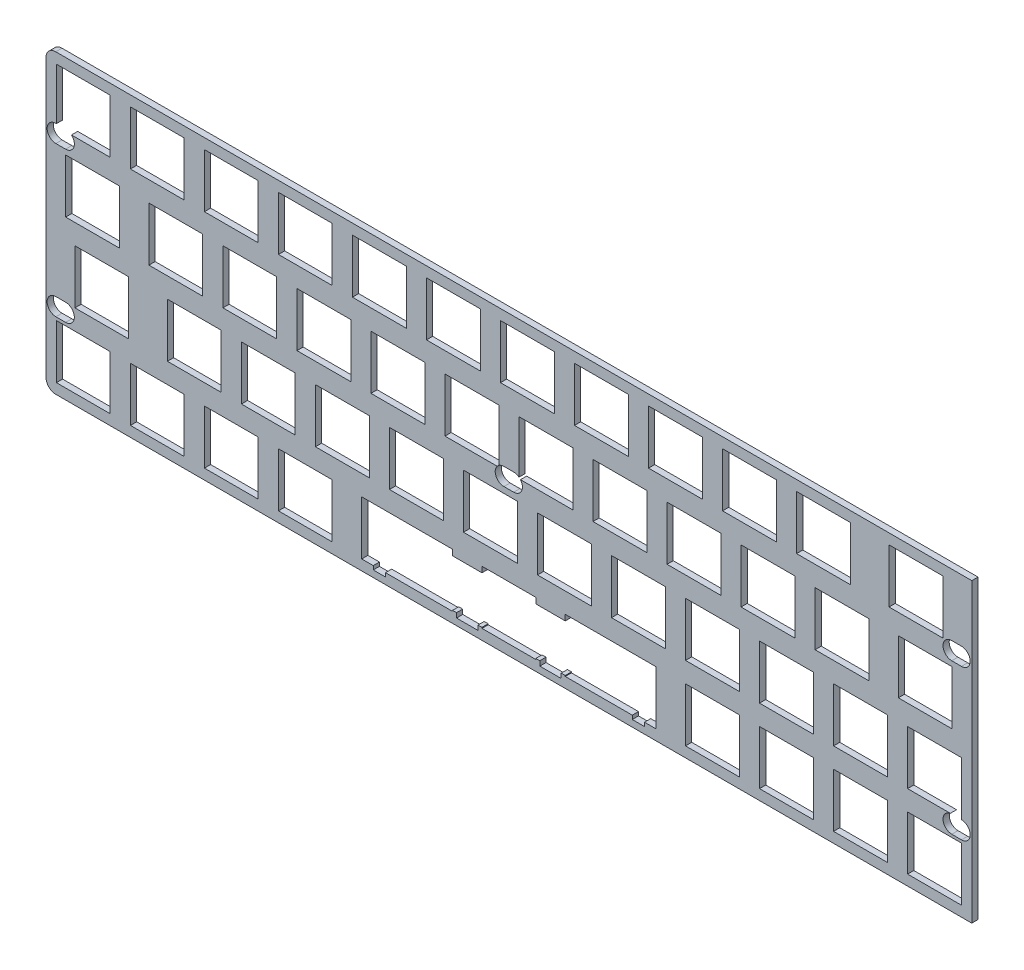
from build123d import *

# Parameters (mm, degrees)
MODEL_W             = 238.2749154
MODEL_H             = 76.350013
MODEL_W_2           = 13.849
MODEL_H_2           = 13.84926
MODEL_W_3           = 13.8491
MODEL_W_4           = 13.84934
MODEL_H_3           = 13.8492
MODEL_W_5           = 13.85
MODEL_W_6           = 13.8504
MODEL_W_7           = 13.85071
MODEL_W_8           = 13.851
MODEL_H_4           = 13.849
MODEL_W_9           = 13.8505
MODEL_W_10          = 13.84928
BOSS_EXTRUDE1_DEPTH = 1.6
FILLET1_R           = 2.5
CUT_EXTRUDE1_DEPTH  = 1.6


with BuildPart() as part:
    # Model → Boss-Extrude1 (new body)
    with BuildSketch(Plane.XY):
        with Locations((119.2325423, 38.2824935)):
            Rectangle(MODEL_W, MODEL_H)
        Polygon((81.3513, 16.6329), (81.3513, 2.78364), (84.3248, 2.78364), (84.3248, 1.8135), (87.4751, 1.8135), (87.4751, 2.78364), (104.725, 2.78364), (104.725, 3.01377), (105.756, 3.01377), (105.756, 1.8135), (111.275, 1.8135), (111.275, 3.01377), (112.306, 3.01377), (112.306, 2.78364), (126.157, 2.78364), (126.157, 3.01377), (127.187, 3.01377), (127.187, 1.8135), (132.707, 1.8135), (132.707, 3.01377), (133.737, 3.01377), (133.737, 2.78364), (150.987, 2.78364), (150.987, 1.8135), (154.138, 1.8135), (154.138, 2.78364), (157.113, 2.78364), (157.113, 16.6329), (133.737, 16.6329), (133.737, 15.1639), (126.157, 15.1639), (126.157, 16.6329), (112.306, 16.6329), (112.306, 15.1639), (104.725, 15.1639), (104.725, 16.6329), align=None, mode=Mode.SUBTRACT)
        with Locations((228.7695, 9.70827)):
            Rectangle(MODEL_W_2, MODEL_H_2, mode=Mode.SUBTRACT)
        with Locations((209.7195, 9.70827)):
            Rectangle(MODEL_W_2, MODEL_H_2, mode=Mode.SUBTRACT)
        with Locations((190.6695, 9.70827)):
            Rectangle(MODEL_W_2, MODEL_H_2, mode=Mode.SUBTRACT)
        with Locations((171.6195, 9.70827)):
            Rectangle(MODEL_W_2, MODEL_H_2, mode=Mode.SUBTRACT)
        with Locations((66.8445, 9.70827)):
            Rectangle(MODEL_W_2, MODEL_H_2, mode=Mode.SUBTRACT)
        with Locations((47.7945, 9.70827)):
            Rectangle(MODEL_W_2, MODEL_H_2, mode=Mode.SUBTRACT)
        with Locations((28.74445, 9.70827)):
            Rectangle(MODEL_W_3, MODEL_H_2, mode=Mode.SUBTRACT)
        with Locations((9.69453, 9.70827)):
            Rectangle(MODEL_W_4, MODEL_H_2, mode=Mode.SUBTRACT)
        with Locations((228.7695, 28.7582)):
            Rectangle(MODEL_W_2, MODEL_H_3, mode=Mode.SUBTRACT)
        with Locations((209.7195, 28.7582)):
            Rectangle(MODEL_W_2, MODEL_H_3, mode=Mode.SUBTRACT)
        with Locations((190.6695, 28.7582)):
            Rectangle(MODEL_W_2, MODEL_H_3, mode=Mode.SUBTRACT)
        with Locations((171.6195, 28.7582)):
            Rectangle(MODEL_W_2, MODEL_H_3, mode=Mode.SUBTRACT)
        with Locations((152.569, 28.7582)):
            Rectangle(MODEL_W_5, MODEL_H_3, mode=Mode.SUBTRACT)
        with Locations((133.519, 28.7582)):
            Rectangle(MODEL_W_5, MODEL_H_3, mode=Mode.SUBTRACT)
        with Locations((114.469, 28.7582)):
            Rectangle(MODEL_W_5, MODEL_H_3, mode=Mode.SUBTRACT)
        with Locations((95.4188, 28.7582)):
            Rectangle(MODEL_W_6, MODEL_H_3, mode=Mode.SUBTRACT)
        with Locations((76.3695, 28.7582)):
            Rectangle(MODEL_W_2, MODEL_H_3, mode=Mode.SUBTRACT)
        with Locations((57.3195, 28.7582)):
            Rectangle(MODEL_W_2, MODEL_H_3, mode=Mode.SUBTRACT)
        with Locations((38.26945, 28.7582)):
            Rectangle(MODEL_W_3, MODEL_H_3, mode=Mode.SUBTRACT)
        with Locations((14.456345, 28.7582)):
            Rectangle(MODEL_W_7, MODEL_H_3, mode=Mode.SUBTRACT)
        with Locations((226.3875, 47.8083)):
            Rectangle(MODEL_W_8, MODEL_H_4, mode=Mode.SUBTRACT)
        with Locations((204.9565, 47.8083)):
            Rectangle(MODEL_W_8, MODEL_H_4, mode=Mode.SUBTRACT)
        with Locations((185.9065, 47.8083)):
            Rectangle(MODEL_W_8, MODEL_H_4, mode=Mode.SUBTRACT)
        with Locations((166.8565, 47.8083)):
            Rectangle(MODEL_W_8, MODEL_H_4, mode=Mode.SUBTRACT)
        with Locations((147.8065, 47.8083)):
            Rectangle(MODEL_W_8, MODEL_H_4, mode=Mode.SUBTRACT)
        with Locations((128.7565, 47.8083)):
            Rectangle(MODEL_W_8, MODEL_H_4, mode=Mode.SUBTRACT)
        with Locations((109.7065, 47.8083)):
            Rectangle(MODEL_W_8, MODEL_H_4, mode=Mode.SUBTRACT)
        with Locations((90.6563, 47.8083)):
            Rectangle(MODEL_W_6, MODEL_H_4, mode=Mode.SUBTRACT)
        with Locations((71.6063, 47.8083)):
            Rectangle(MODEL_W_6, MODEL_H_4, mode=Mode.SUBTRACT)
        with Locations((52.5563, 47.8083)):
            Rectangle(MODEL_W_6, MODEL_H_4, mode=Mode.SUBTRACT)
        with Locations((33.50625, 47.8083)):
            Rectangle(MODEL_W_9, MODEL_H_4, mode=Mode.SUBTRACT)
        with Locations((12.07576, 47.8083)):
            Rectangle(MODEL_W_10, MODEL_H_4, mode=Mode.SUBTRACT)
        with Locations((224.0065, 66.8583)):
            Rectangle(MODEL_W_8, MODEL_H_4, mode=Mode.SUBTRACT)
        with Locations((200.1945, 66.8583)):
            Rectangle(MODEL_W_2, MODEL_H_4, mode=Mode.SUBTRACT)
        with Locations((181.1445, 66.8583)):
            Rectangle(MODEL_W_2, MODEL_H_4, mode=Mode.SUBTRACT)
        with Locations((162.0945, 66.8583)):
            Rectangle(MODEL_W_2, MODEL_H_4, mode=Mode.SUBTRACT)
        with Locations((143.0445, 66.8583)):
            Rectangle(MODEL_W_2, MODEL_H_4, mode=Mode.SUBTRACT)
        with Locations((123.9945, 66.8583)):
            Rectangle(MODEL_W_2, MODEL_H_4, mode=Mode.SUBTRACT)
        with Locations((104.9445, 66.8583)):
            Rectangle(MODEL_W_2, MODEL_H_4, mode=Mode.SUBTRACT)
        with Locations((85.8945, 66.8583)):
            Rectangle(MODEL_W_2, MODEL_H_4, mode=Mode.SUBTRACT)
        with Locations((66.8445, 66.8583)):
            Rectangle(MODEL_W_2, MODEL_H_4, mode=Mode.SUBTRACT)
        with Locations((47.7945, 66.8583)):
            Rectangle(MODEL_W_2, MODEL_H_4, mode=Mode.SUBTRACT)
        with Locations((28.74445, 66.8583)):
            Rectangle(MODEL_W_3, MODEL_H_4, mode=Mode.SUBTRACT)
        with Locations((9.69453, 66.8583)):
            Rectangle(MODEL_W_4, MODEL_H_4, mode=Mode.SUBTRACT)
    extrude(amount=BOSS_EXTRUDE1_DEPTH)

    # Fillet1
    fillet1_edges = [part.edges().sort_by_distance(p)[0] for p in [
        (0.0950846, 0.107487, 0.8),
        (0.0950846, 76.4575, 0.8),
    ]]
    fillet(fillet1_edges, radius=FILLET1_R)

    # Sketch10 → Cut-Extrude1 (cut)
    with BuildSketch(Plane.XY.offset(1.6)):
        with BuildLine():
            Line((2.6350846, 60.5175), (5.1369846, 60.5175))
            ThreePointArc((5.1369846, 60.5175), (7.3866646, 58.26782), (5.1369846, 56.01814))
            Line((5.1369846, 56.01814), (2.6350846, 56.01814))
            ThreePointArc((2.6350846, 56.01814), (0.3854046, 58.26782), (2.6350846, 60.5175))
        make_face()
        with BuildLine():
            Line((2.6350846, 21.906847), (5.1369846, 21.906847))
            ThreePointArc((5.1369846, 21.906847), (7.3866646, 19.657167), (5.1369846, 17.407487))
            Line((5.1369846, 17.407487), (2.6350846, 17.407487))
            ThreePointArc((2.6350846, 17.407487), (0.3854046, 19.657167), (2.6350846, 21.906847))
        make_face()
        with BuildLine():
            Line((117.9581, 41.7175), (120.46, 41.7175))
            ThreePointArc((120.46, 41.7175), (122.70968, 39.46782), (120.46, 37.21814))
            Line((120.46, 37.21814), (117.9581, 37.21814))
            ThreePointArc((117.9581, 37.21814), (115.70842, 39.46782), (117.9581, 41.7175))
        make_face()
        with BuildLine():
            Line((233.2081, 60.5175), (235.71, 60.5175))
            ThreePointArc((235.71, 60.5175), (237.95968, 58.26782), (235.71, 56.01814))
            Line((235.71, 56.01814), (233.2081, 56.01814))
            ThreePointArc((233.2081, 56.01814), (230.95842, 58.26782), (233.2081, 60.5175))
        make_face()
        with BuildLine():
            Line((235.70298578, 17.3475116), (233.225200027, 17.364891763))
            ThreePointArc((233.225200027, 17.364891763), (230.977477149, 19.616611536), (233.229196923, 21.864334414))
            Line((233.229196923, 21.864334414), (235.734545235, 21.846760916))
            ThreePointArc((235.734545235, 21.846760916), (237.968390172, 19.581356531), (235.70298578, 17.3475116))
        make_face()
    extrude(amount=-CUT_EXTRUDE1_DEPTH, mode=Mode.SUBTRACT)


solid = part.part
